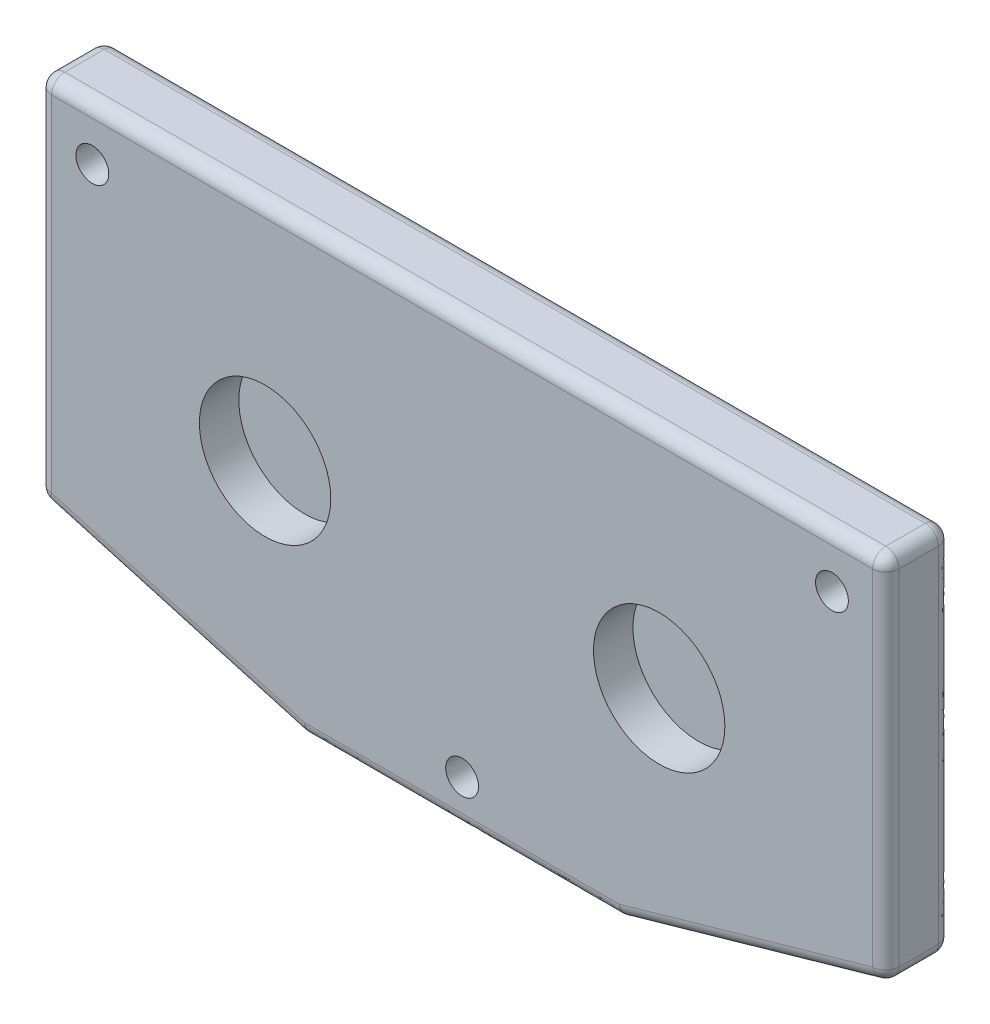
from build123d import *

# Parameters (mm, degrees)
BODY_DEPTH          = 5
SKETCH2_R           = 5
LOCATINGHOLES_DEPTH = 3
SKETCH3_R           = 1.25
SCREWHOLES_DEPTH    = 51.463476892
VARFILLET1_R        = 1


with BuildPart() as part:
    # Sketch1 → Body (new body)
    with BuildSketch(Plane.XY):
        with BuildLine():
            Line((-16.25, 17), (46.25, 17))
            ThreePointArc((46.25, 17), (46.957106781, 16.707106781), (47.25, 16))
            Line((47.25, 16), (47.25, -10.24539276))
            ThreePointArc((47.25, -10.24539276), (47.048231269, -10.847743855), (46.524346317, -11.207023717))
            Line((46.524346317, -11.207023717), (27.229752574, -16.711630957))
            ThreePointArc((27.229752574, -16.711630957), (27.093914456, -16.740361287), (26.955406257, -16.75))
            Line((26.955406257, -16.75), (3.044593743, -16.75))
            ThreePointArc((3.044593743, -16.75), (2.906085544, -16.740361287), (2.770247426, -16.711630957))
            Line((2.770247426, -16.711630957), (-16.524346317, -11.207023717))
            ThreePointArc((-16.524346317, -11.207023717), (-17.048231269, -10.847743855), (-17.25, -10.24539276))
            Line((-17.25, -10.24539276), (-17.25, 16))
            ThreePointArc((-17.25, 16), (-16.957106781, 16.707106781), (-16.25, 17))
        make_face()
    extrude(amount=BODY_DEPTH)

    # Sketch2 → LocatingHoles (cut)
    with BuildSketch(Plane.XY.offset(5)):
        Circle(SKETCH2_R)
        with Locations((30, 0)):
            Circle(SKETCH2_R)
    extrude(amount=-LOCATINGHOLES_DEPTH, mode=Mode.SUBTRACT)

    # Sketch3 → ScrewHoles (cut, through all)
    with BuildSketch(Plane.XY):
        with Locations((15, -13.35)):
            Circle(SKETCH3_R)
        with Locations((-13.15, 12.96)):
            Circle(SKETCH3_R)
        with Locations((43.15, 12.96)):
            Circle(SKETCH3_R)
    extrude(amount=SCREWHOLES_DEPTH, mode=Mode.SUBTRACT)

    # VarFillet1
    varfillet1_edges = [part.edges().sort_by_distance(p)[0] for p in [
        (15, -16.75, 5),
        (47.25, 2.87730362, 0),
    ]]
    fillet(varfillet1_edges, radius=VARFILLET1_R)


solid = part.part
